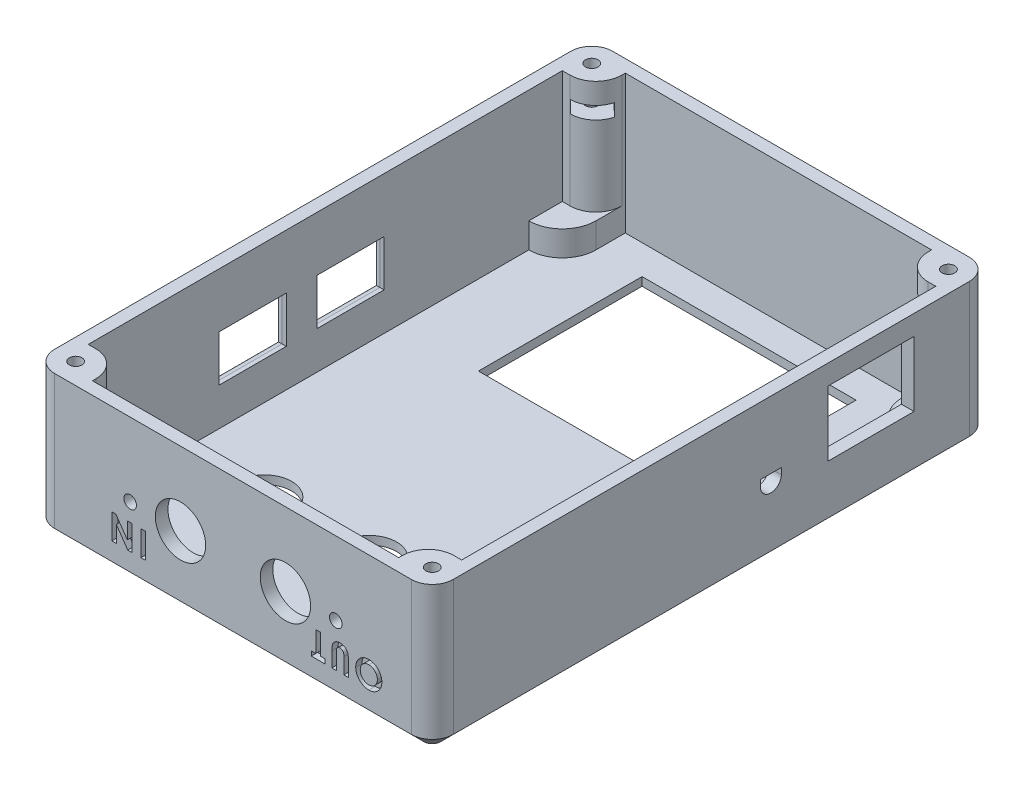
from build123d import *

# Parameters (mm, degrees)
SKETCH_1_W           = 95
SKETCH_1_H           = 133
EXTRUDE_1_DEPTH      = 35
SKETCH_2_W           = 89
SKETCH_2_H           = 127
CUT_EXTRUDE_1_DEPTH  = 33
EXTRUDE_2_DEPTH      = 5
EXTRUDE_3_DEPTH      = 33
SKETCH_5_W           = 51
SKETCH_5_H           = 39
CUT_EXTRUDE_2_DEPTH  = 33
SKETCH_6_R           = 6.5
CUT_EXTRUDE_3_DEPTH  = 33
SKETCH_7_W           = 8
SKETCH_7_H           = 16.57325841
SKETCH_7_W_2         = 9.581135281
EXTRUDE_4_DEPTH      = 3
FILLET_1_R           = 5
CHAMFER_1_SIZE       = 3
SKETCH_9_R           = 6
CUT_EXTRUDE_4_DEPTH  = 10
EXTRUDE_6_DEPTH      = 1
SKETCH_11_W          = 16
SKETCH_11_H          = 11
CUT_EXTRUDE_5_DEPTH  = 147
FILLET_2_R           = 2
CUT_EXTRUDE_6_DEPTH  = 3
SKETCH_13_R          = 1.5
CUT_EXTRUDE_7_DEPTH  = 15
SKETCH_14_W          = 20.5
SKETCH_14_H          = 15.5
CUT_EXTRUDE_8_DEPTH  = 15
SKETCH_16_R          = 1.5
CUT_EXTRUDE_9_DEPTH  = 9
SKETCH_19_W          = 1.076923077
SKETCH_19_H          = 6
CUT_EXTRUDE_10_DEPTH = 1.5


# Read off the part's stored shape, not the designer's step: Бобышка-Вытянуть6
with BuildPart() as part:
    # Эскиз1 → Бобышка-Вытянуть1 (new body)
    with BuildSketch(Plane(origin=(0, 0, 0), x_dir=(1, 0, 0), z_dir=(0, 1, 0))):
        with Locations((0, -4)):
            Rectangle(SKETCH_1_W, SKETCH_1_H)
    extrude(amount=EXTRUDE_1_DEPTH)

    # Эскиз2 → Вырез-Вытянуть1 (cut)
    with BuildSketch(Plane(origin=(0, 35, 0), x_dir=(1, 0, 0), z_dir=(0, 1, 0))):
        with Locations((0, -4)):
            Rectangle(SKETCH_2_W, SKETCH_2_H)
    extrude(amount=-CUT_EXTRUDE_1_DEPTH, mode=Mode.SUBTRACT)

    # Эскиз3 → Бобышка-Вытянуть2 (add)
    with BuildSketch(Plane(origin=(0, 2, 0), x_dir=(1, 0, 0), z_dir=(0, 1, 0))):
        with BuildLine():
            Line((-44.5, 44.5), (-46.17982356, 44.678351017))
            Line((-46.17982356, 44.678351017), (-46.17982356, 61.217902476))
            Line((-46.17982356, 61.217902476), (-36.5, 61.217902476))
            Line((-36.5, 61.217902476), (-36.5, 52.5))
            ThreePointArc((-36.5, 52.5), (-38.84314575, 46.843145751), (-44.5, 44.5))
        make_face()
        with BuildLine():
            Line((44.5, 44.5), (46.017885199, 44.645318305))
            Line((46.017885199, 44.645318305), (46.017885199, 61.217902476))
            Line((46.017885199, 61.217902476), (36.5, 61.217902476))
            Line((36.5, 61.217902476), (36.5, 52.5))
            ThreePointArc((36.5, 52.5), (38.843145751, 46.843145751), (44.5, 44.5))
        make_face()
        with BuildLine():
            Line((-44.5, -44.5), (-46.561318275, -44.5))
            Line((-46.561318275, -44.5), (-46.561318275, -68.929486454))
            Line((-46.561318275, -68.929486454), (-36.5, -68.929486454))
            Line((-36.5, -68.929486454), (-36.5, -52.5))
            ThreePointArc((-36.5, -52.5), (-38.84314575, -46.843145751), (-44.5, -44.5))
        make_face()
        with BuildLine():
            Line((44.5, -44.5), (46.456364004, -44.5))
            Line((46.456364004, -44.5), (46.456364004, -68.929486454))
            Line((46.456364004, -68.929486454), (36.5, -68.929486454))
            Line((36.5, -68.929486454), (36.5, -52.5))
            ThreePointArc((36.5, -52.5), (38.843145751, -46.843145751), (44.5, -44.5))
        make_face()
    extrude(amount=EXTRUDE_2_DEPTH)

    # Эскиз4 → Бобышка-Вытянуть3 (add)
    with BuildSketch(Plane(origin=(0, 35, 0), x_dir=(1, 0, 0), z_dir=(0, 1, 0))):
        with BuildLine():
            Line((-42.667603025, 52.5), (-46.288874902, 52.5))
            Line((-46.288874902, 52.5), (-46.288874902, 61.257999957))
            Line((-46.288874902, 61.257999957), (-36.5, 61.257999957))
            Line((-36.5, 61.257999957), (-36.5, 58.667603026))
            ThreePointArc((-36.5, 58.667603026), (-38.306449103, 54.306449103), (-42.667603025, 52.5))
        make_face()
        with BuildLine():
            Line((42.667603026, 52.5), (46.23233289, 52.5))
            Line((46.23233289, 52.5), (46.23233289, 61.436775562))
            Line((46.23233289, 61.436775562), (36.5, 61.436775562))
            Line((36.5, 61.436775562), (36.5, 58.667603026))
            ThreePointArc((36.5, 58.667603026), (38.306449103, 54.306449103), (42.667603026, 52.5))
        make_face()
        with BuildLine():
            Line((-42.667603025, -60.500000002), (-46.288874902, -60.500000002))
            Line((-46.288874902, -60.500000002), (-46.288874902, -69.170029453))
            Line((-46.288874902, -69.170029453), (-36.5, -69.170029453))
            Line((-36.5, -69.170029453), (-36.5, -66.667603027))
            ThreePointArc((-36.5, -66.667603027), (-38.306449102, -62.306449104), (-42.667603025, -60.500000002))
        make_face()
        with BuildLine():
            Line((36.5, -66.667603027), (36.5, -69.422612028))
            Line((36.5, -69.422612028), (46.23233289, -69.422612028))
            Line((46.23233289, -69.422612028), (46.23233289, -60.500000002))
            Line((46.23233289, -60.500000002), (42.667603025, -60.500000002))
            ThreePointArc((42.667603025, -60.500000002), (38.306449102, -62.306449104), (36.5, -66.667603027))
        make_face()
    extrude(amount=-EXTRUDE_3_DEPTH)

    # Эскиз5 → Вырез-Вытянуть2 (cut)
    with BuildSketch(Plane(origin=(0, 2, 0), x_dir=(1, 0, 0), z_dir=(0, 1, 0))):
        with Locations((0, 32.999999998)):
            Rectangle(SKETCH_5_W, SKETCH_5_H)
    extrude(amount=-CUT_EXTRUDE_2_DEPTH, mode=Mode.SUBTRACT)

    # Эскиз6 → Вырез-Вытянуть3 (cut)
    with BuildSketch(Plane(origin=(0, 2, 0), x_dir=(1, 0, 0), z_dir=(0, 1, 0))):
        with Locations(Location((-25, -38.022, 0), (0, 0, 270))):
            Circle(SKETCH_6_R)
        with Locations(Location((0, -38.022, 0), (0, 0, 270))):
            Circle(SKETCH_6_R)
        with Locations(Location((25, -38.022, 0), (0, 0, 270))):
            Circle(SKETCH_6_R)
    extrude(amount=-CUT_EXTRUDE_3_DEPTH, mode=Mode.SUBTRACT)

    # Эскиз7 → Бобышка-Вытянуть4 (add)
    with BuildSketch(Plane(origin=(0, 7, 0), x_dir=(1, 0, 0), z_dir=(0, 1, 0))):
        with Locations((-40.5, -61.286629205)):
            Rectangle(SKETCH_7_W, SKETCH_7_H)
        with Locations((41.290567641, -61.286629205)):
            Rectangle(SKETCH_7_W_2, SKETCH_7_H)
    extrude(amount=EXTRUDE_4_DEPTH)

    # Скругление1
    fillet_1_edges = [part.edges().sort_by_distance(p)[0] for p in [
        (-47.5, 17.5, -62.5),
        (47.5, 17.5, -62.5),
        (47.5, 17.5, 70.5),
        (-47.5, 17.5, 70.5),
    ]]
    fillet(fillet_1_edges, radius=FILLET_1_R)

    # Фаска1
    chamfer_1_edges = [part.edges().sort_by_distance(p)[0] for p in [
        (0, 0, 70.5),
        (-47.5, 0, 4),
        (0, 0, -62.5),
        (47.5, 0, 4),
        (46.035533906, 0, -61.035533906),
        (-46.035533906, 0, -61.035533906),
        (46.035533906, 0, 69.035533906),
        (-46.035533906, 0, 69.035533906),
    ]]
    chamfer(chamfer_1_edges, length=CHAMFER_1_SIZE)

    # Эскиз9 → Вырез-Вытянуть4 (cut)
    with BuildSketch(Plane.XY.offset(70.5)):
        with Locations((-12.5, 17.5)):
            Circle(SKETCH_9_R)
        with Locations((12.5, 17.5)):
            Circle(SKETCH_9_R)
    extrude(amount=-CUT_EXTRUDE_4_DEPTH, mode=Mode.SUBTRACT)

    # Бобышка-Вытянуть6 outline → Бобышка-Вытянуть6 (add)
    with BuildSketch(Plane(origin=(0, 7, 0), x_dir=(1, 0, 0), z_dir=(0, 1, 0))):
        with BuildLine():
            ThreePointArc((-36.5, -52.5), (-38.913691235, -46.913691235), (-44.5, -44.5))
            Line((-44.5, -44.5), (-44.5, -53))
            Line((-44.5, -53), (-36.5, -53))
            Line((-36.5, -53), (-36.5, -52.5))
        make_face()
        with BuildLine():
            ThreePointArc((-44.5, 44.5), (-38.84314575, 46.84314575), (-36.5, 52.5))
            Line((-36.5, 52.5), (-36.5, 58.667603026))
            ThreePointArc((-36.5, 58.667603026), (-38.306449102, 54.306449103), (-42.667603025, 52.5))
            Line((-42.667603025, 52.5), (-44.5, 52.5))
            Line((-44.5, 52.5), (-44.5, 44.5))
        make_face()
        with BuildLine():
            Line((44.5, -53), (44.5, -44.5))
            ThreePointArc((44.5, -44.5), (38.913691235, -46.913691235), (36.5, -52.5))
            Line((36.5, -52.5), (36.5, -53))
            Line((36.5, -53), (44.5, -53))
        make_face()
        with BuildLine():
            ThreePointArc((36.5, 52.5), (38.843145751, 46.843145751), (44.5, 44.5))
            Line((44.5, 44.5), (44.5, 52.5))
            Line((44.5, 52.5), (42.667603026, 52.5))
            ThreePointArc((42.667603026, 52.5), (38.306449102, 54.306449102), (36.5, 58.667603026))
            Line((36.5, 58.667603026), (36.5, 52.5))
        make_face()
    extrude(amount=EXTRUDE_6_DEPTH)

    # Эскиз11 → Вырез-Вытянуть5 (cut)
    with BuildSketch(Plane(origin=(-44.5, 0, 0), x_dir=(0, 0, -1), z_dir=(1, 0, 0))):
        with Locations((-21.3, 16.5)):
            Rectangle(SKETCH_11_W, SKETCH_11_H)
        with Locations((2, 16.5)):
            Rectangle(SKETCH_11_W, SKETCH_11_H)
    extrude(amount=-CUT_EXTRUDE_5_DEPTH, mode=Mode.SUBTRACT)

    # Скругление2
    fillet_2_edges = [part.edges().sort_by_distance(p)[0] for p in [
        (-47.5, 11, -2),
        (-47.5, 16.5, -10),
        (-47.5, 22, -2),
        (-47.5, 16.5, 6),
        (-47.5, 16.5, 29.3),
        (-47.5, 11, 21.3),
        (-47.5, 16.5, 13.3),
        (-47.5, 22, 21.3),
    ]]
    fillet(fillet_2_edges, radius=FILLET_2_R)

    # Эскиз12 → Вырез-Вытянуть6 (cut)
    with BuildSketch(Plane(origin=(0, 30, 0), x_dir=(1, 0, 0), z_dir=(0, 1, 0))):
        Polygon((-43.456898005, 53.342160696), (-38.669227384, 48.886566227), (-34.102886499, 54.74571156), (-38.415547717, 58.759243608), (-41.543101995, 61.669868553), (-45.627554278, 60.41663957), (-46.584452283, 56.252785641), align=None)
        Polygon((43.070132488, 53.270443647), (46.454292076, 55.878277464), (45.887921536, 60.112962546), (41.937391408, 61.739813811), (38.55323182, 59.131979994), (33.975821992, 55.604627388), (38.138700428, 49.470281463), align=None)
        Polygon((38.415657707, -66.768044791), (41.562725194, -69.657560246), (45.638652726, -68.376877582), (46.567512771, -64.206679464), (43.420445285, -61.317164008), (37.721420366, -56.084540097), (32.716632788, -61.535420879), align=None)
        Polygon((-44.066619778, -61.530465433), (-46.726785826, -64.873645047), (-45.161590375, -68.84900623), (-40.936228876, -69.481187799), (-38.276062828, -66.138008185), (-34.562613218, -61.471108146), (-40.353170168, -56.863565395), align=None)
    extrude(amount=-CUT_EXTRUDE_6_DEPTH, mode=Mode.SUBTRACT)

    # Эскиз13 → Вырез-Вытянуть7 (cut)
    with BuildSketch(Plane(origin=(0, 35, 0), x_dir=(1, 0, 0), z_dir=(0, 1, 0))):
        with Locations(Location((-42.50561964, 57.50561964, 0), (0, 0, 270))):
            Circle(SKETCH_13_R)
        with Locations(Location((42.50561964, 57.50561964, 0), (0, 0, 270))):
            Circle(SKETCH_13_R)
        with Locations(Location((42.505619641, -65.505619641, 0), (0, 0, 270))):
            Circle(SKETCH_13_R)
        with Locations(Location((-42.5, -65.5, 0), (0, 0, 270))):
            Circle(SKETCH_13_R)
    extrude(amount=-CUT_EXTRUDE_7_DEPTH, mode=Mode.SUBTRACT)

    # Эскиз14 → Вырез-Вытянуть8 (cut)
    with BuildSketch(Plane(origin=(47.5, 0, 0), x_dir=(0, 0, -1), z_dir=(1, 0, 0))):
        with BuildLine():
            Line((7.680097505, 19), (7.680097505, 17.5))
            ThreePointArc((7.680097505, 17.5), (10.180097505, 15), (12.680097505, 17.5))
            Line((12.680097505, 17.5), (12.680097505, 19))
            Line((12.680097505, 19), (7.680097505, 19))
        make_face()
        with Locations((34.061570059, 22.5)):
            Rectangle(SKETCH_14_W, SKETCH_14_H)
    extrude(amount=-CUT_EXTRUDE_8_DEPTH, mode=Mode.SUBTRACT)

    # Эскиз16 → Вырез-Вытянуть9 (cut)
    with BuildSketch(Plane.XY.offset(70.5)):
        with Locations((-24.5, 17.5)):
            Circle(SKETCH_16_R)
        with Locations((24.5, 17.5)):
            Circle(SKETCH_16_R)
    extrude(amount=-CUT_EXTRUDE_9_DEPTH, mode=Mode.SUBTRACT)

    # Эскиз19 → Вырез-Вытянуть10 (cut)
    # profile 1 of 5: a face of its own
    with BuildSketch(Plane.XY.offset(70.5)):
        with BuildLine():
            add(Edge.make_bspline(
                [(32.38189291, 7.104469824), (32.486210784, 7.107169702), (32.692157895, 7.112499873), (32.995022761, 7.156964506), (33.286924062, 7.229329866), (33.56790364, 7.330340254), (33.837003217, 7.461157766), (34.095211534, 7.619995665), (34.341820997, 7.808201755), (34.573956389, 8.023090329), (34.786818859, 8.258064262), (34.973927389, 8.508580324), (35.132758814, 8.772052044), (35.261682666, 9.048530757), (35.362362896, 9.337636688), (35.432334471, 9.639479556), (35.477450485, 9.953672836), (35.482627289, 10.167613724), (35.485258295, 10.276344824)],
                knots=[0, 0, 0, 0, 1.014151002, 2.002163778, 2.969868608, 3.93493411, 4.9003771, 5.874719092, 6.87846472, 7.912488755, 8.947011879, 9.957751389, 10.948740761, 11.933621513, 12.919426746, 13.920294397, 14.943031967, 16, 16, 16, 16], degree=3))
            add(Edge.make_bspline(
                [(35.485258295, 10.276344824), (35.482455503, 10.38385057), (35.476932511, 10.59569409), (35.434181761, 10.906994903), (35.362994058, 11.205593571), (35.264254822, 11.491592176), (35.137585231, 11.764995406), (34.981179469, 12.024916101), (34.796065127, 12.271888317), (34.586023568, 12.504399006), (34.356212622, 12.716822336), (34.111353215, 12.903303925), (33.853720216, 13.060152156), (33.584959682, 13.190339553), (33.302536164, 13.288171678), (33.009580869, 13.361399314), (32.703643142, 13.403743565), (32.495802372, 13.409327721), (32.390306372, 13.412162132)],
                knots=[0, 0, 0, 0, 1.051517626, 2.07204922, 3.067438659, 4.05042616, 5.027204762, 6.009981242, 7.012629434, 8.042243656, 9.071350414, 10.070091277, 11.048190212, 12.017682766, 12.985867053, 13.966945899, 14.968060614, 16, 16, 16, 16], degree=3))
            add(Edge.make_bspline(
                [(32.390306372, 13.412162132), (32.279961665, 13.409649333), (32.0631494, 13.404712027), (31.745764914, 13.358156572), (31.442116535, 13.28717658), (31.153036265, 13.184414632), (30.878748832, 13.050889786), (30.618024173, 12.889668725), (30.372823169, 12.697637242), (30.143963148, 12.480587333), (29.936639567, 12.243025535), (29.753629528, 11.992078545), (29.599258084, 11.729644127), (29.473517308, 11.455604471), (29.374388434, 11.171661356), (29.304464252, 10.876085835), (29.263158374, 10.569586711), (29.257404705, 10.361406383), (29.254489064, 10.255912132)],
                knots=[0, 0, 0, 0, 1.067953136, 2.098381936, 3.099641766, 4.083805132, 5.062469929, 6.048665414, 7.046702845, 8.073106546, 9.098695993, 10.09591865, 11.076726721, 12.041940862, 13.011263376, 13.984305721, 14.978557872, 16, 16, 16, 16], degree=3))
            add(Edge.make_bspline(
                [(29.254489064, 10.255912132), (29.255416785, 10.1849442), (29.257260481, 10.043906952), (29.278982092, 9.834842699), (29.311197897, 9.630158754), (29.355300561, 9.429470216), (29.414721514, 9.233294273), (29.486942857, 9.04113608), (29.571103484, 8.852996702), (29.668155322, 8.670577591), (29.777940313, 8.496061295), (29.895161063, 8.327923577), (30.024307373, 8.170578386), (30.162713608, 8.022316565), (30.310921891, 7.883815854), (30.469190345, 7.754603331), (30.637269857, 7.635008562), (30.813342424, 7.52404328), (30.996805742, 7.426854933), (31.183294875, 7.338760813), (31.374600095, 7.267334124), (31.569332397, 7.208176291), (31.767044075, 7.160699727), (31.969261635, 7.129131861), (32.174278407, 7.107238646), (32.312523839, 7.105394955), (32.38189291, 7.104469824)],
                knots=[0, 0, 0, 0, 1.034641744, 2.056182551, 3.061960284, 4.05571729, 5.050247014, 6.048716841, 7.047801973, 8.054190544, 9.059424999, 10.053182006, 11.041513076, 12.025412457, 13.009311837, 13.997642908, 15.002928308, 16.016213968, 17.030509951, 18.02913364, 19.022134519, 20.005478534, 20.996155877, 21.984625117, 22.988721131, 24, 24, 24, 24], degree=3))
        make_face()
        with BuildLine():
            add(Edge.make_bspline(
                [(32.365065987, 8.181392901), (32.294860426, 8.183276676), (32.156302741, 8.186994495), (31.953063792, 8.215319175), (31.757947448, 8.260557086), (31.572034266, 8.326083018), (31.394522357, 8.409483146), (31.225082556, 8.510455967), (31.066116195, 8.63251091), (30.915291686, 8.76894928), (30.779506035, 8.921600973), (30.657416341, 9.083410912), (30.558701869, 9.258272514), (30.473821515, 9.440426311), (30.411124246, 9.63447878), (30.363386813, 9.837280465), (30.337385853, 10.050913271), (30.333431747, 10.196152539), (30.331412141, 10.270335209)],
                knots=[0, 0, 0, 0, 1.033668485, 2.040047952, 3.016132939, 3.979056467, 4.937231767, 5.900589077, 6.877725736, 7.88429546, 8.891280164, 9.882584218, 10.863295226, 11.842887319, 12.837417301, 13.860812229, 14.907384602, 16, 16, 16, 16], degree=3))
            add(Edge.make_bspline(
                [(30.331412141, 10.270335209), (30.333867071, 10.352569188), (30.338678327, 10.513734162), (30.372038424, 10.748963316), (30.430491815, 10.970858317), (30.510346191, 11.180161481), (30.616495436, 11.374671864), (30.743452328, 11.556747579), (30.894395591, 11.725258939), (31.010476705, 11.823724863), (31.06939291, 11.873700593)],
                knots=[0, 0, 0, 0, 1.078343132, 2.113373867, 3.107373148, 4.082093053, 5.043582658, 6.005574554, 6.987742499, 8, 8, 8, 8], degree=3))
            add(Edge.make_bspline(
                [(31.06939291, 11.873700593), (31.117669388, 11.91061489), (31.213134666, 11.983611797), (31.365518033, 12.077172308), (31.522442896, 12.157362999), (31.685093449, 12.222156129), (31.853126183, 12.273121316), (32.026518055, 12.308811399), (32.205023384, 12.331210012), (32.325737052, 12.333887071), (32.386700603, 12.335239055)],
                knots=[0, 0, 0, 0, 1.023928204, 2.024787132, 3.009472467, 3.9914905, 4.972207045, 5.96565515, 6.972602802, 8, 8, 8, 8], degree=3))
            add(Edge.make_bspline(
                [(32.386700603, 12.335239055), (32.455697643, 12.333336612), (32.591451488, 12.329593495), (32.790926104, 12.301655998), (32.981940202, 12.254168756), (33.16626428, 12.189682801), (33.341430102, 12.103260452), (33.510169247, 12.000640541), (33.670470634, 11.878622574), (33.820380088, 11.738745843), (33.957764088, 11.586086949), (34.079310695, 11.423401797), (34.179971323, 11.250684058), (34.2639351, 11.070240865), (34.329352231, 10.880635514), (34.37412077, 10.681853704), (34.402892653, 10.474697429), (34.406498343, 10.333733889), (34.408335218, 10.261921747)],
                knots=[0, 0, 0, 0, 1.026350473, 2.019376834, 2.989435443, 3.95094063, 4.91865229, 5.889827372, 6.885283771, 7.910196595, 8.935871797, 9.9372888, 10.925850568, 11.904605667, 12.894245083, 13.903507864, 14.931967858, 16, 16, 16, 16], degree=3))
            add(Edge.make_bspline(
                [(34.408335218, 10.261921747), (34.406441903, 10.190519598), (34.402715201, 10.049975358), (34.374621142, 9.843393759), (34.327915725, 9.64570419), (34.261906043, 9.456397056), (34.179671715, 9.274478509), (34.076371708, 9.101527447), (33.954245103, 8.937693502), (33.815524476, 8.783950689), (33.664560435, 8.64266142), (33.502478906, 8.520050431), (33.333822867, 8.413504754), (33.154720494, 8.330041324), (32.9688366, 8.263546145), (32.775036769, 8.214578152), (32.572587013, 8.18719347), (32.434856256, 8.183343659), (32.365065987, 8.181392901)],
                knots=[0, 0, 0, 0, 1.055040155, 2.076685641, 3.074845078, 4.052329834, 5.035358467, 6.020382375, 7.023447318, 8.050688466, 9.077178457, 10.074336316, 11.0503314, 12.019748348, 12.988025369, 13.964577102, 14.968620271, 16, 16, 16, 16], degree=3))
        make_face(mode=Mode.SUBTRACT)
    # profile 2 of 5: a face of its own
    with BuildSketch(Plane.XY.offset(70.5)):
        with BuildLine():
            Line((23.577565987, 7.258315978), (24.654489064, 7.258315978))
            Line((24.654489064, 7.258315978), (24.654489064, 11.162162132))
            add(Edge.make_bspline(
                [(24.654489064, 11.162162132), (24.654550003, 11.202635236), (24.654667707, 11.280808619), (24.660298061, 11.392966318), (24.665604599, 11.496445034), (24.674633505, 11.590405987), (24.688795981, 11.675140851), (24.702018645, 11.750961814), (24.720147163, 11.817193174), (24.747294701, 11.89263339), (24.789678141, 11.977382385), (24.856902023, 12.066711304), (24.937178724, 12.146221584), (25.031716808, 12.212982124), (25.137265294, 12.269448957), (25.255904246, 12.306797038), (25.383776883, 12.33212957), (25.472865845, 12.334183175), (25.518671757, 12.335239055)],
                knots=[0, 0, 0, 0, 1.155195489, 2.231248153, 3.20507519, 4.113220553, 4.92363642, 5.657123012, 6.309133385, 6.880755525, 7.944644177, 8.999147208, 10.058600405, 11.156792429, 12.29246015, 13.460660758, 14.694375292, 16, 16, 16, 16], degree=3))
            add(Edge.make_bspline(
                [(25.518671757, 12.335239055), (25.567287852, 12.333835865), (25.662081006, 12.331099882), (25.798702889, 12.303664294), (25.92563615, 12.260995662), (26.039412736, 12.198854181), (26.140443122, 12.125498304), (26.224262693, 12.039846347), (26.293293845, 11.946275628), (26.336688081, 11.858177192), (26.361857466, 11.777861017), (26.3783454, 11.705482499), (26.392401391, 11.621183743), (26.404756017, 11.524602029), (26.411947404, 11.415406781), (26.420039156, 11.29407868), (26.422954923, 11.160572493), (26.423457668, 11.067610235), (26.423719833, 11.019133286)],
                knots=[0, 0, 0, 0, 1.260834212, 2.45841325, 3.603280198, 4.724942815, 5.811019112, 6.833506895, 7.823953325, 8.819576102, 9.365694356, 10.006623749, 10.745436914, 11.584131356, 12.533575865, 13.586103333, 14.74122738, 16, 16, 16, 16], degree=3))
            Line((26.423719833, 11.019133286), (26.423719833, 7.258315978))
            Line((26.423719833, 7.258315978), (27.50064291, 7.258315978))
            Line((27.50064291, 7.258315978), (27.50064291, 10.837642901))
            add(Edge.make_bspline(
                [(27.50064291, 10.837642901), (27.500512716, 10.910161234), (27.500262365, 11.049606915), (27.495591062, 11.249978806), (27.48703377, 11.433085646), (27.476411463, 11.598595541), (27.463673183, 11.7469813), (27.447187634, 11.878167227), (27.427021137, 11.992082974), (27.396797182, 12.121747073), (27.344708804, 12.271054411), (27.260709653, 12.442976331), (27.154077939, 12.611287701), (27.02807199, 12.774191546), (26.885689725, 12.925358739), (26.730753321, 13.058511783), (26.564102627, 13.168855607), (26.386886857, 13.259048612), (26.195815276, 13.327863612), (25.990974594, 13.376279928), (25.771627899, 13.407475252), (25.620545644, 13.410568523), (25.542710218, 13.412162132)],
                knots=[0, 0, 0, 0, 1.170912322, 2.251550202, 3.235884933, 4.130507595, 4.929373885, 5.640290569, 6.26461063, 6.796528574, 7.788739464, 8.810047518, 9.879767716, 11.000329969, 12.130634485, 13.227340211, 14.291294104, 15.350161901, 16.430664233, 17.561930962, 18.743941553, 20, 20, 20, 20], degree=3))
            add(Edge.make_bspline(
                [(25.542710218, 13.412162132), (25.49099014, 13.411288367), (25.388947487, 13.409564447), (25.2388621, 13.39444632), (25.093827778, 13.371977796), (24.953753492, 13.339858865), (24.819173606, 13.295925373), (24.689364026, 13.244454003), (24.564188055, 13.184449148), (24.446464737, 13.112934561), (24.333738856, 13.036798083), (24.228901802, 12.954894375), (24.132420331, 12.8682393), (24.044375741, 12.776697759), (23.964772484, 12.680300533), (23.893588709, 12.579060452), (23.830979277, 12.472925802), (23.775354857, 12.359999828), (23.727751047, 12.234537697), (23.687599035, 12.092081575), (23.652694033, 11.930769415), (23.626270801, 11.749538578), (23.602982014, 11.549214219), (23.587891836, 11.329031857), (23.580102689, 11.08970394), (23.578432921, 10.923786288), (23.577565987, 10.837642901)],
                knots=[0, 0, 0, 0, 1.001274302, 1.975493657, 2.918061388, 3.842055805, 4.754744607, 5.656586832, 6.54484551, 7.438946169, 8.321187755, 9.177850665, 10.012845812, 10.830395126, 11.634995211, 12.431362049, 13.224358528, 14.018909421, 14.866105371, 15.818803578, 16.882454076, 18.059767828, 19.363726729, 20.787034531, 22.331848803, 24, 24, 24, 24], degree=3))
            Line((23.577565987, 10.837642901), (23.577565987, 7.258315978))
        make_face()
    # profile 3 of 5: a face of its own
    with BuildSketch(Plane.XY.offset(70.5)):
        Polygon((18.66987368, 7.258315978), (21.90064291, 7.258315978), (21.90064291, 8.335239055), (20.823719833, 8.335239055), (20.823719833, 13.258315978), (19.746796757, 13.258315978), (19.746796757, 8.335239055), (18.66987368, 8.335239055), align=None)
    # profile 4 of 5: a face of its own
    with BuildSketch(Plane.XY.offset(70.5)):
        Polygon((-24.105688423, 7.258315978), (-25.075640347, 7.258315978), (-27.797996116, 11.206633286), (-27.797996116, 7.258315978), (-28.874919193, 7.258315978), (-28.874919193, 13.258315978), (-27.897755731, 13.258315978), (-25.1826115, 9.322017901), (-25.1826115, 13.258315978), (-24.105688423, 13.258315978), align=None)
    # profile 5 of 5: a face of its own
    with BuildSketch(Plane.XY.offset(70.5)):
        with Locations((-21.382611501, 10.258315978)):
            Rectangle(SKETCH_19_W, SKETCH_19_H)
    extrude(amount=-CUT_EXTRUDE_10_DEPTH, mode=Mode.SUBTRACT)


solid = part.part
